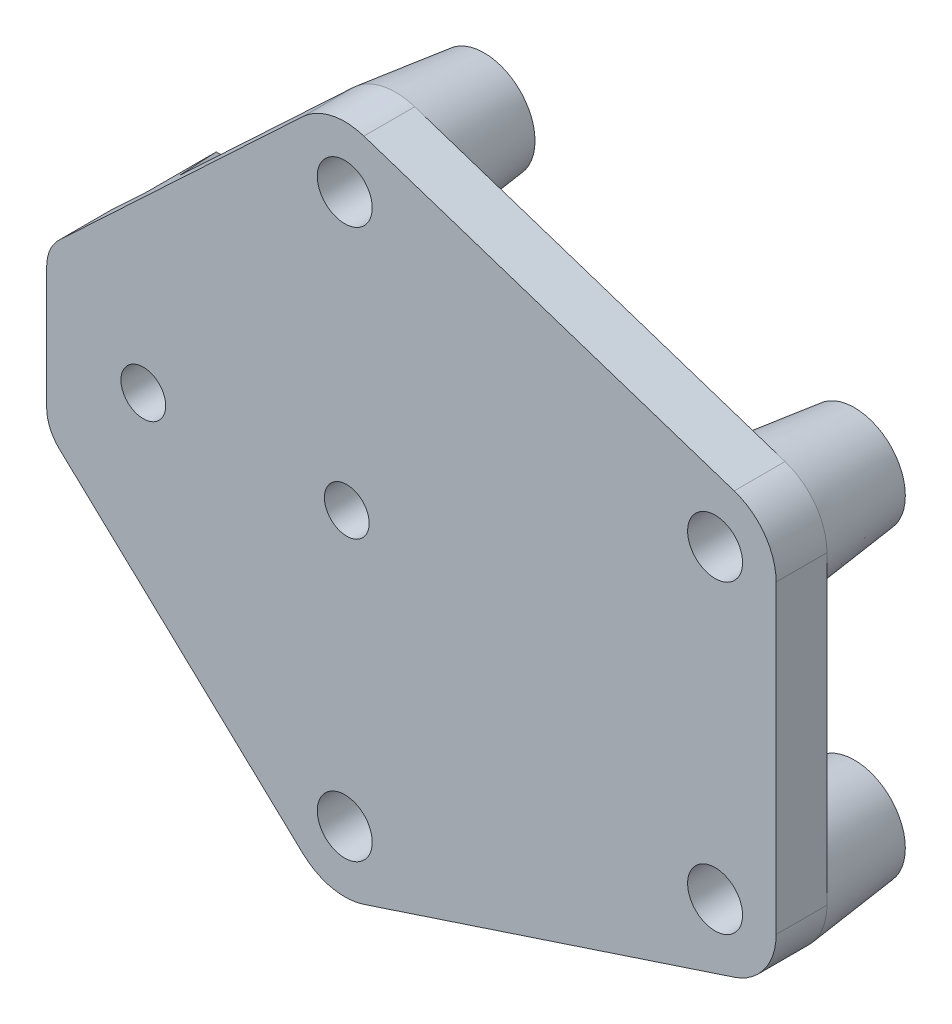
from build123d import *

# Parameters (mm, degrees)
SKETCH_1_R       = 2.7
SKETCH_1_R_2     = 2.2
EXTRUDE_1_DEPTH  = 5
SKETCH_1_4_W     = 29.632105645
SKETCH_1_4_H     = 2
EXTRUDE_2_DEPTH  = 6.8
CHAMFER_1_SIZE   = 3
CHAMFER_1_SIZE_2 = 6.8
CHAMFER_2_SIZE   = 3
CHAMFER_2_SIZE_2 = 6.8


with BuildPart() as part:
    # 草图1 → 凸台-拉伸1 (new body)
    with BuildSketch(Plane.XY):
        with BuildLine():
            Line((-22.305856328, 31.375150719), (-46.237237552, 8.916767146))
            ThreePointArc((-46.237237552, 8.916767146), (-47.170759472, 7.589190013), (-47.5, 6))
            Line((-47.5, 6), (-47.5, -6))
            ThreePointArc((-47.5, -6), (-47.170759472, -7.589190013), (-46.237237552, -8.916767146))
            Line((-46.237237552, -8.916767146), (-22.305856328, -31.375150719))
            ThreePointArc((-22.305856328, -31.375150719), (-19.495338483, -32.858506483), (-16.321429443, -32.698330691))
            Line((-16.321429443, -32.698330691), (20.078570557, -20.698330691))
            ThreePointArc((20.078570557, -20.698330691), (23.061657297, -18.516288999), (24.2, -15))
            Line((24.2, -15), (24.2, 15))
            ThreePointArc((24.2, 15), (23.061657297, 18.516288999), (20.078570557, 20.698330691))
            Line((20.078570557, 20.698330691), (-16.321429443, 32.698330691))
            ThreePointArc((-16.321429443, 32.698330691), (-19.495338483, 32.858506483), (-22.305856328, 31.375150719))
        make_face()
        with Locations((18.2, -15)):
            Circle(SKETCH_1_R, mode=Mode.SUBTRACT)
        with Locations((-38, 0)):
            Circle(SKETCH_1_R_2, mode=Mode.SUBTRACT)
        with Locations((-18, 0)):
            Circle(SKETCH_1_R_2, mode=Mode.SUBTRACT)
        with Locations((-18.2, 27)):
            Circle(SKETCH_1_R, mode=Mode.SUBTRACT)
        with Locations((18.2, 15)):
            Circle(SKETCH_1_R, mode=Mode.SUBTRACT)
        with Locations((-18.2, -27)):
            Circle(SKETCH_1_R, mode=Mode.SUBTRACT)
    extrude(amount=EXTRUDE_1_DEPTH)

    # 草图4 → 旋转1 (revolve)
    with BuildSketch(Plane(origin=(6.244417819, 18.941400719, 0), x_dir=(-0.9497217817885489, 0.3130950928973239, 0), z_dir=(-0.3130950928973239, -0.9497217817885489, 0)), mode=Mode.PRIVATE) as revolve_1_sk:
        Polygon((-6.588510035, 0), (-7.588510035, 8.7), (-9.888510035, 8.7), (-9.888510035, 0), align=None)
    revolve_1 = revolve(revolve_1_sk.sketch.rotate(Axis((18.2, 15, 4.45283877), (0, 0, -1)), 161.754145472), axis=Axis((18.2, 15, 4.45283877), (0, 0, -1)))

    # 草图4<3> → 旋转2 (revolve)
    with BuildSketch(Plane(origin=(6.244417819, 18.941400719, 0), x_dir=(-0.9497217817885489, 0.3130950928973239, 0), z_dir=(-0.3130950928973239, -0.9497217817885489, 0)), mode=Mode.PRIVATE) as revolve_2_sk:
        Polygon((30.738503937, 8.7), (28.438503937, 8.7), (28.438503937, 0), (31.738503937, 0), align=None)
    revolve_2 = revolve(revolve_2_sk.sketch.rotate(Axis((-18.2, 27, 0), (0, 0, -1)), 161.754145472), axis=Axis((-18.2, 27, 0), (0, 0, -1)))

    # 镜向1: 旋转1, 旋转2 across plane
    add(revolve_1.mirror(Plane.ZX))
    add(revolve_2.mirror(Plane.ZX))

    # 草图1<4> → 凸台-拉伸2 (add)
    with BuildSketch(Plane.XY):
        with Locations((-27.816052823, 11.3)):
            Rectangle(SKETCH_1_4_W, SKETCH_1_4_H)
        with Locations((-27.816052823, -11.3)):
            Rectangle(SKETCH_1_4_W, SKETCH_1_4_H)
    extrude(amount=-EXTRUDE_2_DEPTH)

    # 倒角1
    # the kernel refuses this chamfer: 6.8, 3 mm, written as the material it adds along each edge
    with BuildSketch(Plane(origin=(-13, 12.3, 0), x_dir=(0, 0.9968133817371192, 0.07976892872421078), z_dir=(-1, 0, 0))) as chamfer_1_piece_1_section:
        Polygon((CHAMFER_1_SIZE * 0.996813381737, CHAMFER_1_SIZE * 0.0797689287242), (-CHAMFER_1_SIZE_2 * 0.0797689287242, CHAMFER_1_SIZE_2 * 0.996813381737), (0, 0), align=None)
    chamfer_1_piece_1 = extrude(amount=29.632105645, mode=Mode.PRIVATE)
    chamfer_1_piece_1 = split(chamfer_1_piece_1, bisect_by=Plane(origin=(-34.029834246, 20.372793997, -2.314232385), z_dir=(0.6843093880009448, -0.7291917864963733, 0)), keep=Keep.TOP, mode=Mode.PRIVATE)
    chamfer_1_piece_1 = split(chamfer_1_piece_1, bisect_by=Plane(origin=(-27.32033499, 13.223232944, -6.8), z_dir=(0, 0, 1)), keep=Keep.TOP, mode=Mode.PRIVATE)
    add(chamfer_1_piece_1)

    # 倒角2
    # the kernel refuses this chamfer: 6.8, 3 mm, written as the material it adds along each edge
    with BuildSketch(Plane(origin=(-42.632105645, -12.3, 0), x_dir=(0, -0.9968133817371192, 0.07976892872421078), z_dir=(1, 0, 0))) as chamfer_2_piece_1_section:
        Polygon((CHAMFER_2_SIZE * 0.996813381737, CHAMFER_2_SIZE * 0.0797689287242), (-CHAMFER_2_SIZE_2 * 0.0797689287242, CHAMFER_2_SIZE_2 * 0.996813381737), (0, 0), align=None)
    chamfer_2_piece_1 = extrude(amount=29.632105645, mode=Mode.PRIVATE)
    chamfer_2_piece_1 = split(chamfer_2_piece_1, bisect_by=Plane(origin=(-34.029834246, -20.372793997, -2.314232385), z_dir=(0.6843093880009445, 0.7291917864963735, 0)), keep=Keep.TOP, mode=Mode.PRIVATE)
    chamfer_2_piece_1 = split(chamfer_2_piece_1, bisect_by=Plane(origin=(-27.32033499, -13.223232944, -6.8), z_dir=(0, 0, 1)), keep=Keep.TOP, mode=Mode.PRIVATE)
    add(chamfer_2_piece_1)


solid = part.part
